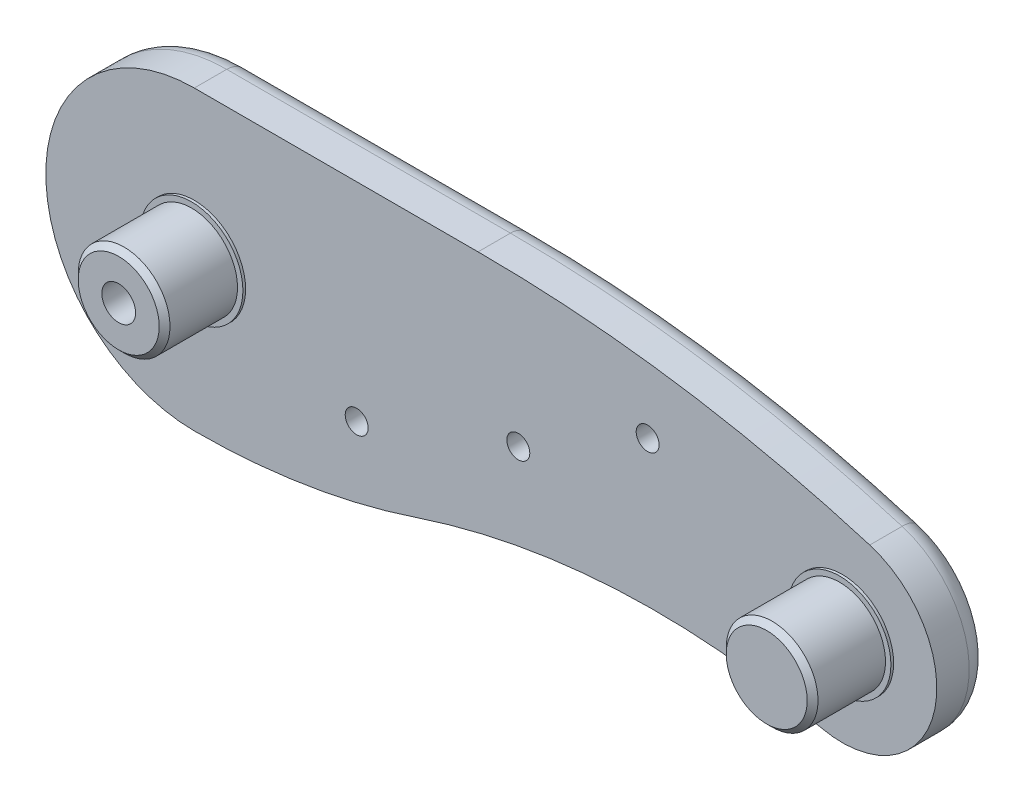
from build123d import *

# Parameters (mm, degrees)
BOSS_EXTRUDE1_DEPTH = 6
BOSS_EXTRUDE3_START = 4
SKETCH3_R           = 10
BOSS_EXTRUDE3_DEPTH = 4
SKETCH4_R           = 8.5
BOSS_EXTRUDE4_DEPTH = 14
SKETCH5_R           = 2.125
CUT_EXTRUDE1_DEPTH  = 143.262082088
SKETCH6_R           = 3.75
CUT_EXTRUDE2_DEPTH  = 4.25
FILLET1_R           = 4
SKETCH7_R           = 9.5
SKETCH7_R_2         = 8.5
BOSS_EXTRUDE5_DEPTH = 0.5
CHAMFER2_SIZE       = 1
SKETCH8_R           = 1.625
CUT_EXTRUDE3_DEPTH  = 142.642154762
SKETCH9_R           = 3.125
CUT_EXTRUDE4_DEPTH  = 17


with BuildPart() as part:
    # Sketch1 → Boss-Extrude1 (new body)
    with BuildSketch(Plane.XY):
        with BuildLine():
            Line((52.546312184, 27.5), (0, 27.5))
            ThreePointArc((0, 27.5), (-27.5, 0), (0, -27.5))
            ThreePointArc((0, -27.5), (20.821970152, -25.821648832), (41.106300643, -20.829931677))
            ThreePointArc((41.106300643, -20.829931677), (78.372680186, -13.821988034), (116.152736046, -17.071864575))
            ThreePointArc((116.152736046, -17.071864575), (136.920766347, -4.465161388), (125.077159298, 16.747311828))
            ThreePointArc((125.077159298, 16.747311828), (89.208090939, 24.797217895), (52.546312184, 27.5))
        make_face()
    extrude(amount=BOSS_EXTRUDE1_DEPTH)

    # Sketch3 → Boss-Extrude3 (add)
    with BuildSketch(Plane(origin=(0, 0, 0), x_dir=(-1, 0, 0), z_dir=(0, 0, -1)).offset(BOSS_EXTRUDE3_START)):
        with BuildLine():
            ThreePointArc((0, -27.5), (27.5, 0), (0, 27.5))
            Line((0, 27.5), (-52.546312184, 27.5))
            ThreePointArc((-52.546312184, 27.5), (-89.208090939, 24.797217895), (-125.077159298, 16.747311828))
            ThreePointArc((-125.077159298, 16.747311828), (-136.920766347, -4.465161388), (-116.152736046, -17.071864575))
            ThreePointArc((-116.152736046, -17.071864575), (-78.372680186, -13.821988034), (-41.106300643, -20.829931677))
            ThreePointArc((-41.106300643, -20.829931677), (-20.821970152, -25.821648832), (0, -27.5))
        make_face()
        Circle(SKETCH3_R, mode=Mode.SUBTRACT)
    extrude(amount=-BOSS_EXTRUDE3_DEPTH)

    # Sketch4 → Boss-Extrude4 (add)
    with BuildSketch(Plane.XY.offset(6)):
        Circle(SKETCH4_R)
        with Locations((120, 0)):
            Circle(SKETCH4_R)
    extrude(amount=BOSS_EXTRUDE4_DEPTH)

    # Sketch5 → Cut-Extrude1 (cut, through all)
    with BuildSketch(Plane(origin=(0, 0, -4), x_dir=(-1, 0, 0), z_dir=(0, 0, -1))):
        with Locations((-83.953508951, 13.296929528)):
            Circle(SKETCH5_R)
        with Locations((-60, 0)):
            Circle(SKETCH5_R)
        with Locations((-30.070163865, -10.944644586)):
            Circle(SKETCH5_R)
    extrude(amount=-CUT_EXTRUDE1_DEPTH, mode=Mode.SUBTRACT)

    # Sketch6 → Cut-Extrude2 (cut)
    with BuildSketch(Plane(origin=(0, 0, -4), x_dir=(-1, 0, 0), z_dir=(0, 0, -1))):
        with Locations((-83.953508951, 13.296929528)):
            Circle(SKETCH6_R)
        with Locations((-60, 0)):
            Circle(SKETCH6_R)
        with Locations((-30.070163865, -10.944644586)):
            Circle(SKETCH6_R)
    extrude(amount=-CUT_EXTRUDE2_DEPTH, mode=Mode.SUBTRACT)

    # Fillet1
    fillet1_edges = [part.edges().sort_by_distance(p)[0] for p in [
        (-27.5, 0, -4),
        (20.821970152, -25.821648832, -4),
        (78.372680186, -13.821988034, -4),
        (136.920766347, -4.465161388, -4),
        (89.208090939, 24.797217895, -4),
        (26.273156092, 27.5, -4),
    ]]
    fillet(fillet1_edges, radius=FILLET1_R)

    # Sketch7 → Boss-Extrude5 (add)
    # profile 1 of 2: a face of its own
    with BuildSketch(Plane.XY.offset(6)):
        Circle(SKETCH7_R)
        Circle(SKETCH7_R_2, mode=Mode.SUBTRACT)
    # profile 2 of 2: a face of its own
    with BuildSketch(Plane.XY.offset(6)):
        with Locations((120, 0)):
            Circle(SKETCH7_R)
        with Locations((120, 0)):
            Circle(SKETCH7_R_2, mode=Mode.SUBTRACT)
    extrude(amount=BOSS_EXTRUDE5_DEPTH)

    # Chamfer2
    chamfer2_edges = [part.edges().sort_by_distance(p)[0] for p in [
        (-8.5, 0, 20),
        (111.5, 0, 20),
    ]]
    chamfer(chamfer2_edges, length=CHAMFER2_SIZE)

    # Sketch8 → Cut-Extrude3 (cut, through all)
    with BuildSketch(Plane(origin=(0, 0, 0), x_dir=(-1, 0, 0), z_dir=(0, 0, -1))):
        Circle(SKETCH8_R)
    extrude(amount=-CUT_EXTRUDE3_DEPTH, mode=Mode.SUBTRACT)

    # Sketch9 → Cut-Extrude4 (cut)
    with BuildSketch(Plane.XY.offset(20)):
        Circle(SKETCH9_R)
    extrude(amount=-CUT_EXTRUDE4_DEPTH, mode=Mode.SUBTRACT)


solid = part.part
